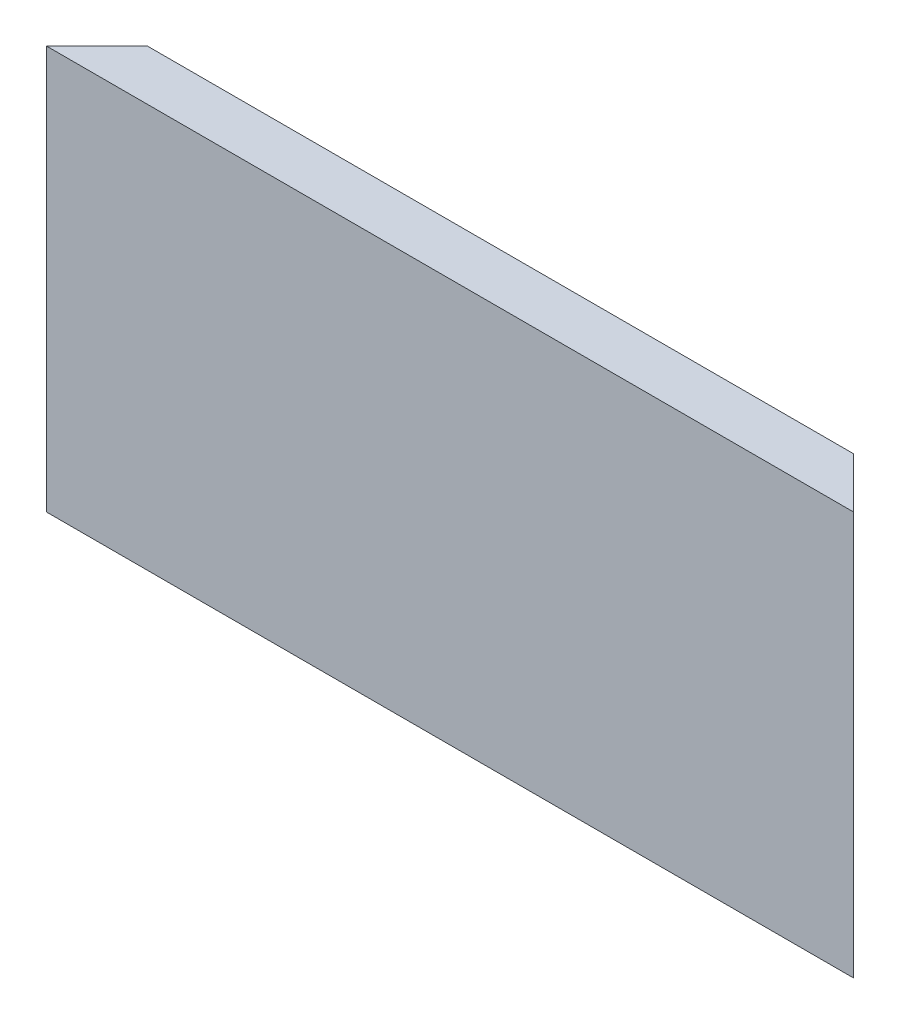
from build123d import *

# Parameters (mm, degrees)
BOSS_EXTRUDE1_DEPTH = 80
CUT_EXTRUDE1_DEPTH  = 80


with BuildPart() as part:
    # Sketch1 → Boss-Extrude1 (new body)
    with BuildSketch(Plane(origin=(0, 0, 0), x_dir=(0, 0, -1), z_dir=(1, 0, 0))):
        Polygon((-2.5, -20), (2.5, -15), (2.5, 20), (-2.5, 20), align=None)
    extrude(amount=BOSS_EXTRUDE1_DEPTH)

    # Sketch2 → Cut-Extrude1 (cut)
    with BuildSketch(Plane(origin=(0, 20, 0), x_dir=(1, 0, 0), z_dir=(0, 1, 0))):
        Polygon((80, 2.5), (75, 2.5), (80, -2.5), align=None)
        Polygon((0, -2.5), (5, 2.5), (0, 2.5), align=None)
    extrude(amount=-CUT_EXTRUDE1_DEPTH, mode=Mode.SUBTRACT)


solid = part.part
